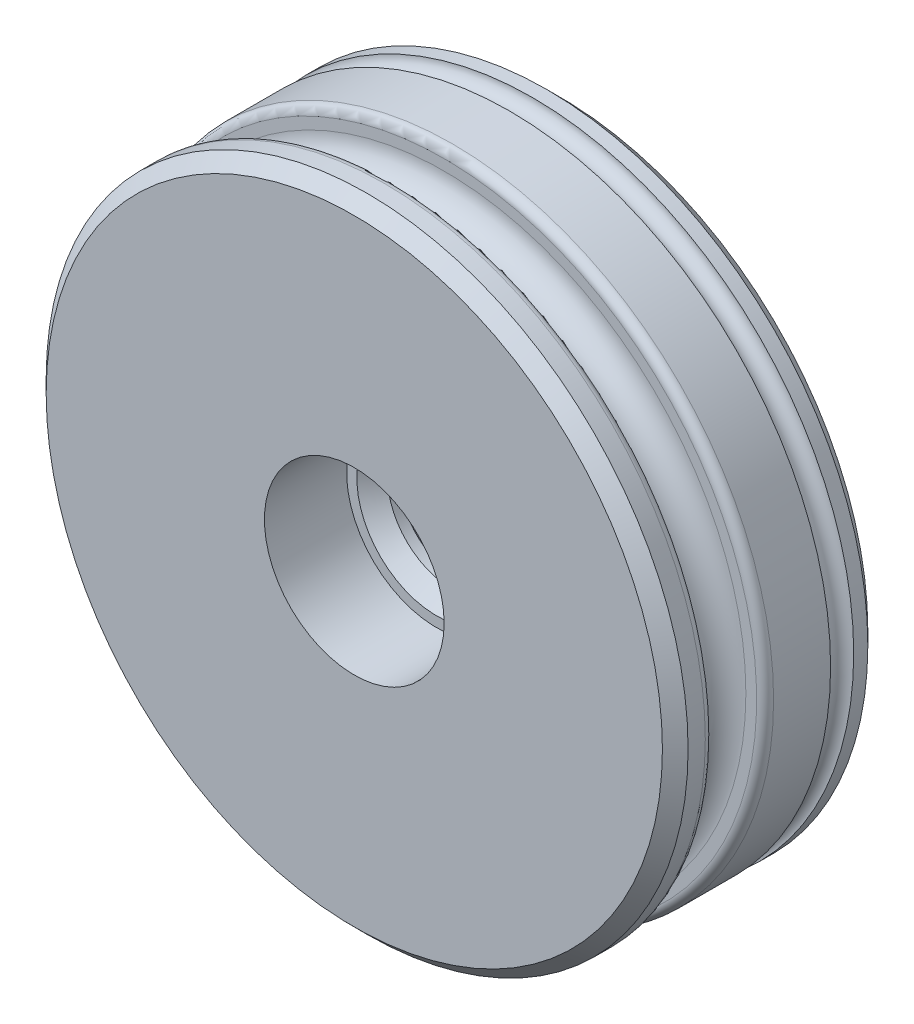
from build123d import *

# Parameters (mm, degrees)
SKETCH1_R                = 12.5
BOSS_EXTRUDE1_DEPTH      = 4
SKETCH2_R                = 3.5
CUT_EXTRUDE1_DEPTH       = 3.2
CHAMFER1_SIZE            = 0.5
SKETCH4_R                = 2.5
CUT_EXTRUDE2_DEPTH       = 18.964965906
CHAMFER2_SIZE            = 0.6
CHAMFER1_OF_MIRROR2_SIZE = 0.5
CHAMFER2_OF_MIRROR2_SIZE = 0.6
SKETCH7_R                = 0.45
FILLET1_R                = 0.33


with BuildPart() as part:
    # Sketch1 → Boss-Extrude1 (new body)
    with BuildSketch(Plane.XY):
        Circle(SKETCH1_R)
    boss_extrude1 = extrude(amount=BOSS_EXTRUDE1_DEPTH)

    # Sketch3 → Cut-Revolve1 (revolve, cut)
    with BuildSketch(Plane(origin=(0, 0, 0), x_dir=(0, 0, -1), z_dir=(1, 0, 0))):
        with BuildLine():
            Line((-2.5, 11.75), (-2.5, 12.75))
            Line((-2.5, 12.75), (-0.5, 12.75))
            Line((-0.5, 12.75), (-0.5, 11.75))
            ThreePointArc((-0.5, 11.75), (-1.5, 10.75), (-2.5, 11.75))
        make_face()
    revolve(axis=Axis((0, 0, -0.35), (0, 0, 1)), mode=Mode.SUBTRACT)

    # Sketch2 → Cut-Extrude1 (cut)
    with BuildSketch(Plane.XY.offset(4)):
        Circle(SKETCH2_R)
    cut_extrude1 = extrude(amount=-CUT_EXTRUDE1_DEPTH, mode=Mode.SUBTRACT)

    # Chamfer1
    chamfer1_edges = [part.edges().sort_by_distance(p)[0] for p in [
        (-12.5, 0, 4),
    ]]
    chamfer(chamfer1_edges, length=CHAMFER1_SIZE)

    # Sketch4 → Cut-Extrude2 (cut, through all)
    with BuildSketch(Plane.XY.offset(0.8)):
        Circle(SKETCH4_R)
    cut_extrude2 = extrude(amount=-CUT_EXTRUDE2_DEPTH, mode=Mode.SUBTRACT)

    # Chamfer2
    chamfer2_edges = [part.edges().sort_by_distance(p)[0] for p in [
        (-2.5, 0, 0.8),
    ]]
    chamfer(chamfer2_edges, length=CHAMFER2_SIZE)

    # Mirror2: Boss-Extrude1, Cut-Extrude1, Cut-Extrude2 across plane
    add(boss_extrude1.mirror(Plane.XY))
    add(cut_extrude1.mirror(Plane.XY), mode=Mode.SUBTRACT)
    add(cut_extrude2.mirror(Plane.XY), mode=Mode.SUBTRACT)

    # Chamfer1 of Mirror2
    chamfer1_of_mirror2_edges = [part.edges().sort_by_distance(p)[0] for p in [
        (-12.5, 0, -4),
    ]]
    chamfer(chamfer1_of_mirror2_edges, length=CHAMFER1_OF_MIRROR2_SIZE)

    # Chamfer2 of Mirror2
    chamfer2_of_mirror2_edges = [part.edges().sort_by_distance(p)[0] for p in [
        (-2.5, 0, -0.8),
    ]]
    chamfer(chamfer2_of_mirror2_edges, length=CHAMFER2_OF_MIRROR2_SIZE)

    # Sketch7 → Cut-Revolve3 (revolve, cut)
    with BuildSketch(Plane(origin=(0, 0, 0), x_dir=(0, 0, -1), z_dir=(1, 0, 0))):
        with Locations((2.5, 12.5)):
            Circle(SKETCH7_R)
    revolve(axis=Axis((0, 0, -0.35), (0, 0, 1)), mode=Mode.SUBTRACT)

    # Fillet1
    fillet1_edges = [part.edges().sort_by_distance(p)[0] for p in [
        (-12.5, 0, 2.5),
        (-12.5, 0, 0.5),
    ]]
    fillet(fillet1_edges, radius=FILLET1_R)


solid = part.part
